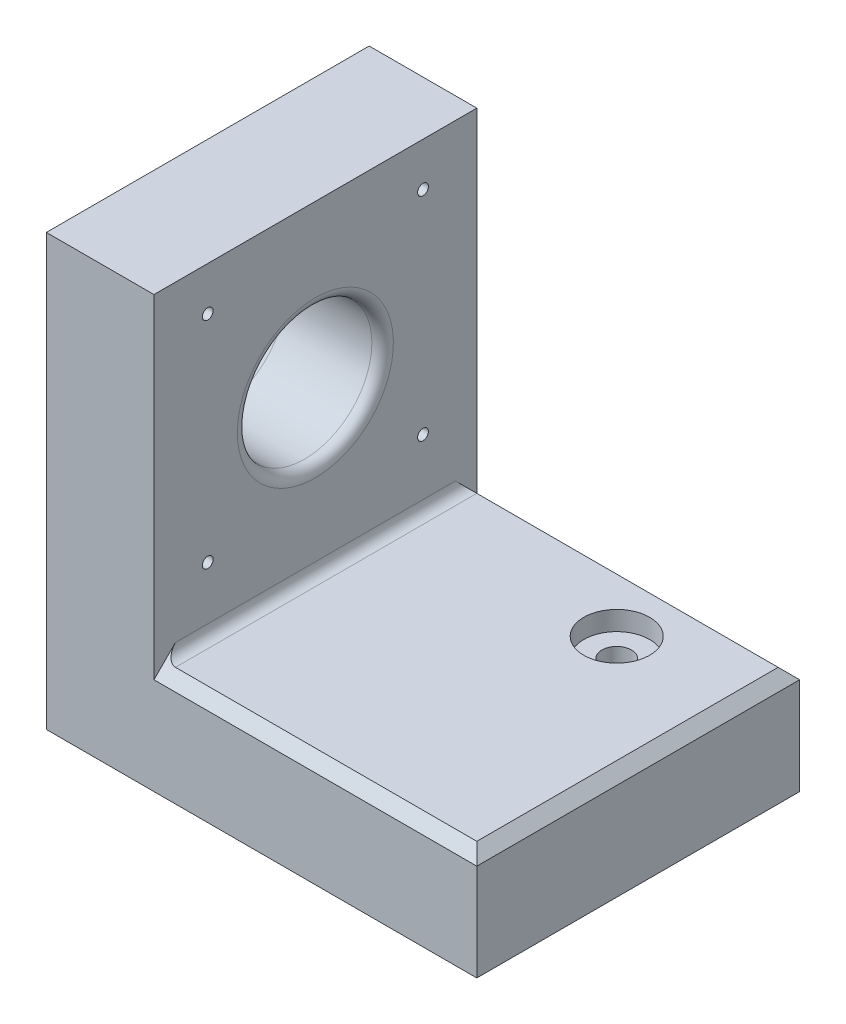
from build123d import *

# Parameters (mm, degrees)
BOSS_EXTRUDE1_DEPTH    = 60
F_3DSKETCH1_R          = 1
CUT_EXTRUDE1_DEPTH     = 10
CUT_EXTRUDE3_OUTLINE_R = 12.5
CUT_EXTRUDE3_DEPTH     = 20
FILLET1_R              = 2
CUT_EXTRUDE4_DEPTH     = 60
FILLET2_R              = 2
CUT_EXTRUDE5_DEPTH     = 60
CUT_EXTRUDE8_START     = 16.42
CUT_EXTRUDE8_OUTLINE_R = 6.12
CUT_EXTRUDE8_DEPTH     = 3.58
CUT_EXTRUDE9_OUTLINE_R = 2.75
CUT_EXTRUDE9_DEPTH     = 16.42


# Read off the part's stored shape, not the designer's step: Cut-Extrude3, Cut-Extrude8, Cut-Extrude9
with BuildPart() as part:
    # Sketch1 → Boss-Extrude1 (new body)
    with BuildSketch(Plane.XY):
        Polygon((0, 0), (0, 80), (20, 80), (20, 20), (80, 20), (80, 0), align=None)
    extrude(amount=-BOSS_EXTRUDE1_DEPTH)

    # 3DSketch1 → Cut-Extrude1 (cut)
    with BuildSketch(Plane(origin=(20, 71.90061973, -50), x_dir=(0, -0.7071067811865477, 0.7071067811865475), z_dir=(-1, 0, 0))):
        with Locations(Location((0, 0, 0), (0, 0, 225))):
            Circle(F_3DSKETCH1_R)
        with Locations(Location((28.284271247, 28.284271247, 0), (0, 0, 225))):
            Circle(F_3DSKETCH1_R)
        with Locations(Location((27.881964101, -27.881964101, 0), (0, 0, 225))):
            Circle(F_3DSKETCH1_R)
        with Locations(Location((56.568542495, 0, 0), (0, 0, 225))):
            Circle(F_3DSKETCH1_R)
    extrude(amount=CUT_EXTRUDE1_DEPTH, mode=Mode.SUBTRACT)

    # Cut-Extrude3 outline → Cut-Extrude3 (cut)
    with BuildSketch(Plane.YZ):
        with Locations((50, -30)):
            Circle(CUT_EXTRUDE3_OUTLINE_R)
    extrude(amount=CUT_EXTRUDE3_DEPTH, mode=Mode.SUBTRACT)

    # Fillet1
    fillet1_edges = [part.edges().sort_by_distance(p)[0] for p in [
        (20, 37.5, -30),
        (0, 37.5, -30),
    ]]
    fillet(fillet1_edges, radius=FILLET1_R)

    # Sketch7 → Cut-Extrude4 (cut)
    with BuildSketch(Plane(origin=(80, 0, 0), x_dir=(0, 0, -1), z_dir=(1, 0, 0))):
        Polygon((0, 20), (2, 20), (0, 18), align=None)
        Polygon((60, 20), (58, 20), (60, 18), align=None)
    extrude(amount=-CUT_EXTRUDE4_DEPTH, mode=Mode.SUBTRACT)

    # Fillet2
    fillet2_edges = [part.edges().sort_by_distance(p)[0] for p in [
        (20, 20, -30),
    ]]
    fillet(fillet2_edges, radius=FILLET2_R)

    # Sketch8 → Cut-Extrude5 (cut)
    with BuildSketch(Plane.XY):
        Polygon((78, 20), (80, 20), (80, 18), align=None)
    extrude(amount=-CUT_EXTRUDE5_DEPTH, mode=Mode.SUBTRACT)

    # Cut-Extrude8 outline → Cut-Extrude8 (cut)
    with BuildSketch(Plane(origin=(0, 0, 0), x_dir=(1, 0, 0), z_dir=(0, 1, 0)).offset(CUT_EXTRUDE8_START)):
        with Locations((58, 48)):
            Circle(CUT_EXTRUDE8_OUTLINE_R)
    extrude(amount=CUT_EXTRUDE8_DEPTH, mode=Mode.SUBTRACT)

    # Cut-Extrude9 outline → Cut-Extrude9 (cut)
    with BuildSketch(Plane(origin=(0, 0, 0), x_dir=(1, 0, 0), z_dir=(0, 1, 0))):
        with Locations((58, 48)):
            Circle(CUT_EXTRUDE9_OUTLINE_R)
    extrude(amount=CUT_EXTRUDE9_DEPTH, mode=Mode.SUBTRACT)


solid = part.part
